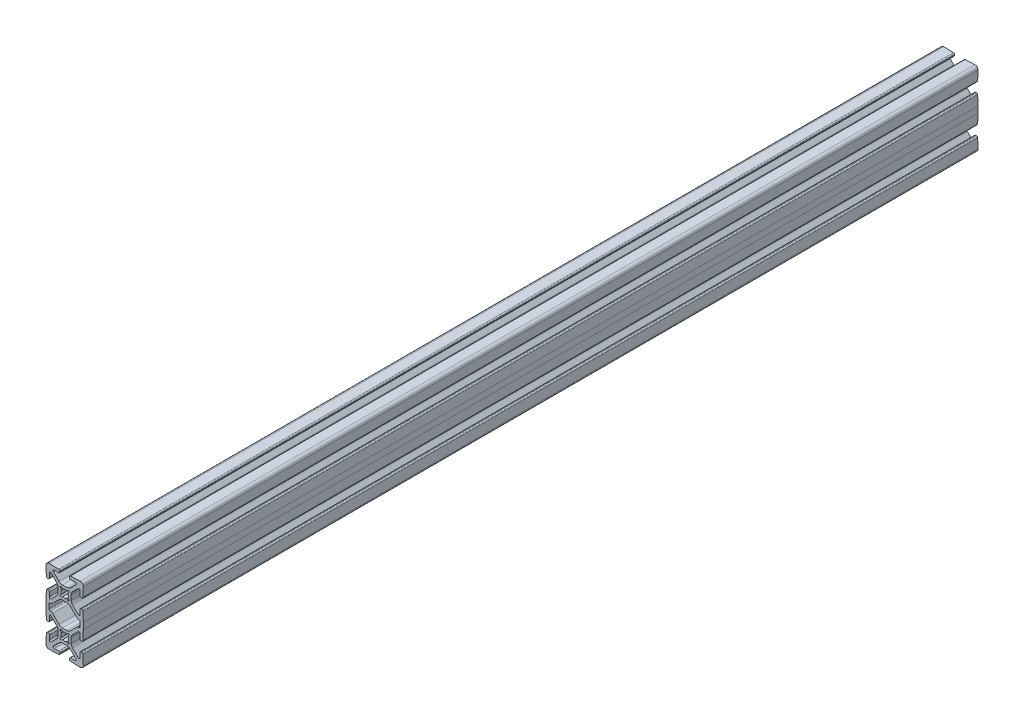
from build123d import *

# Parameters (mm, degrees)
BOSS_EXTRUDE1_DEPTH = 300
CIRPATTERN1_COUNT   = 2


with BuildPart() as part:
    # Sketch3 → Boss-Extrude1 (new, symmetric)
    with BuildSketch(Plane.XY):
        with BuildLine():
            Line((-4.38, 10.941265504), (-4.38, 14.058734496))
            ThreePointArc((-4.38, 14.058734496), (-4.621682484, 15.273754393), (-5.30993597, 16.303798526))
            Line((-5.30993597, 16.303798526), (-9.020191678, 20.014054234))
            ThreePointArc((-9.020191678, 20.014054234), (-9.863839779, 20.17422583), (-10.32206431, 19.447983903))
            Line((-10.32206431, 19.447983903), (-10.221143342, 16.5579855))
            ThreePointArc((-10.221143342, 16.5579855), (-10.425626604, 16.011070171), (-10.956945643, 15.768934135))
            Line((-10.956945643, 15.768934135), (-11.485840127, 15.750464733))
            ThreePointArc((-11.485840127, 15.750464733), (-12.032755455, 15.954947995), (-12.274891491, 16.486267034))
            Line((-12.274891491, 16.486267034), (-12.498762161, 22.897084223))
            ThreePointArc((-12.498762161, 22.897084223), (-11.904840979, 24.404840979), (-10.397084223, 24.998762161))
            Line((-10.397084223, 24.998762161), (-3.986267034, 24.774891491))
            ThreePointArc((-3.986267034, 24.774891491), (-3.454947995, 24.532755455), (-3.250464733, 23.985840127))
            Line((-3.250464733, 23.985840127), (-3.268934135, 23.456945643))
            ThreePointArc((-3.268934135, 23.456945643), (-3.511070171, 22.925626604), (-4.0579855, 22.721143342))
            Line((-4.0579855, 22.721143342), (-6.947983903, 22.82206431))
            ThreePointArc((-6.947983903, 22.82206431), (-7.67422583, 22.363839779), (-7.514054234, 21.520191678))
            Line((-7.514054234, 21.520191678), (-3.803798526, 17.80993597))
            ThreePointArc((-3.803798526, 17.80993597), (-2.773754393, 17.121682484), (-1.558734496, 16.88))
            Line((-1.558734496, 16.88), (1.558734496, 16.88))
            ThreePointArc((1.558734496, 16.88), (2.773754393, 17.121682484), (3.803798526, 17.80993597))
            Line((3.803798526, 17.80993597), (7.514054234, 21.520191678))
            ThreePointArc((7.514054234, 21.520191678), (7.67422583, 22.363839779), (6.947983903, 22.82206431))
            Line((6.947983903, 22.82206431), (4.0579855, 22.721143342))
            ThreePointArc((4.0579855, 22.721143342), (3.511070171, 22.925626604), (3.268934135, 23.456945643))
            Line((3.268934135, 23.456945643), (3.250464733, 23.985840127))
            ThreePointArc((3.250464733, 23.985840127), (3.454947995, 24.532755455), (3.986267034, 24.774891491))
            Line((3.986267034, 24.774891491), (10.397084223, 24.998762161))
            ThreePointArc((10.397084223, 24.998762161), (11.904840979, 24.404840979), (12.498762161, 22.897084223))
            Line((12.498762161, 22.897084223), (12.274891491, 16.486267034))
            ThreePointArc((12.274891491, 16.486267034), (12.032755455, 15.954947995), (11.485840127, 15.750464733))
            Line((11.485840127, 15.750464733), (10.956945643, 15.768934135))
            ThreePointArc((10.956945643, 15.768934135), (10.425626604, 16.011070171), (10.221143342, 16.5579855))
            Line((10.221143342, 16.5579855), (10.32206431, 19.447983903))
            ThreePointArc((10.32206431, 19.447983903), (9.863839779, 20.17422583), (9.020191678, 20.014054234))
            Line((9.020191678, 20.014054234), (5.30993597, 16.303798526))
            ThreePointArc((5.30993597, 16.303798526), (4.621682484, 15.273754393), (4.38, 14.058734496))
            Line((4.38, 14.058734496), (4.38, 10.941265504))
            ThreePointArc((4.38, 10.941265504), (4.621682484, 9.726245607), (5.30993597, 8.696201474))
            Line((5.30993597, 8.696201474), (9.020191678, 4.985945766))
            ThreePointArc((9.020191678, 4.985945766), (9.863839779, 4.82577417), (10.32206431, 5.552016097))
            Line((10.32206431, 5.552016097), (10.221143342, 8.4420145))
            ThreePointArc((10.221143342, 8.4420145), (10.425626604, 8.988929829), (10.956945643, 9.231065865))
            Line((10.956945643, 9.231065865), (11.485840127, 9.249535267))
            ThreePointArc((11.485840127, 9.249535267), (12.032755455, 9.045052005), (12.274891491, 8.513732966))
            Line((12.274891491, 8.513732966), (12.5, 2.067468692))
            Line((12.5, 2.067468692), (12.5, 0))
            Line((12.5, 0), (10.468, 0))
            Line((10.468, 0), (10.468, 1.506))
            ThreePointArc((10.468, 1.506), (10.244815367, 2.044815367), (9.706, 2.268))
            Line((9.706, 2.268), (9.567544515, 2.268))
            ThreePointArc((9.567544515, 2.268), (8.78993178, 2.42267679), (8.130703535, 2.863159021))
            Line((8.130703535, 2.863159021), (3.803798526, 7.19006403))
            ThreePointArc((3.803798526, 7.19006403), (2.773754393, 7.878317516), (1.558734496, 8.12))
            Line((1.558734496, 8.12), (-1.558734496, 8.12))
            ThreePointArc((-1.558734496, 8.12), (-2.773754393, 7.878317516), (-3.803798526, 7.19006403))
            Line((-3.803798526, 7.19006403), (-8.130703535, 2.863159021))
            ThreePointArc((-8.130703535, 2.863159021), (-8.78993178, 2.42267679), (-9.567544515, 2.268))
            Line((-9.567544515, 2.268), (-9.706, 2.268))
            ThreePointArc((-9.706, 2.268), (-10.244815367, 2.044815367), (-10.468, 1.506))
            Line((-10.468, 1.506), (-10.468, 0))
            Line((-10.468, 0), (-12.5, 0))
            Line((-12.5, 0), (-12.5, 2.067468692))
            Line((-12.5, 2.067468692), (-12.274891491, 8.513732966))
            ThreePointArc((-12.274891491, 8.513732966), (-12.032755455, 9.045052005), (-11.485840127, 9.249535267))
            Line((-11.485840127, 9.249535267), (-10.956945643, 9.231065865))
            ThreePointArc((-10.956945643, 9.231065865), (-10.425626604, 8.988929829), (-10.221143342, 8.4420145))
            Line((-10.221143342, 8.4420145), (-10.32206431, 5.552016097))
            ThreePointArc((-10.32206431, 5.552016097), (-9.863839779, 4.82577417), (-9.020191678, 4.985945766))
            Line((-9.020191678, 4.985945766), (-5.30993597, 8.696201474))
            ThreePointArc((-5.30993597, 8.696201474), (-4.621682484, 9.726245607), (-4.38, 10.941265504))
        make_face()
        with BuildLine():
            Line((-2.828427125, 14.430401513), (-2.195333939, 13.797308327))
            ThreePointArc((-2.195333939, 13.797308327), (-2.55, 12.5), (-2.195333939, 11.202691673))
            Line((-2.195333939, 11.202691673), (-2.828427125, 10.569598487))
            ThreePointArc((-2.828427125, 10.569598487), (-2.828427125, 9.671572875), (-1.930401513, 9.671572875))
            Line((-1.930401513, 9.671572875), (-1.297308327, 10.304666061))
            ThreePointArc((-1.297308327, 10.304666061), (0, 9.95), (1.297308327, 10.304666061))
            Line((1.297308327, 10.304666061), (1.930401513, 9.671572875))
            ThreePointArc((1.930401513, 9.671572875), (2.828427125, 9.671572875), (2.828427125, 10.569598487))
            Line((2.828427125, 10.569598487), (2.195333939, 11.202691673))
            ThreePointArc((2.195333939, 11.202691673), (2.55, 12.5), (2.195333939, 13.797308327))
            Line((2.195333939, 13.797308327), (2.828427125, 14.430401513))
            ThreePointArc((2.828427125, 14.430401513), (2.828427125, 15.328427125), (1.930401513, 15.328427125))
            Line((1.930401513, 15.328427125), (1.297308327, 14.695333939))
            ThreePointArc((1.297308327, 14.695333939), (0, 15.05), (-1.297308327, 14.695333939))
            Line((-1.297308327, 14.695333939), (-1.930401513, 15.328427125))
            ThreePointArc((-1.930401513, 15.328427125), (-2.828427125, 15.328427125), (-2.828427125, 14.430401513))
        make_face(mode=Mode.SUBTRACT)
    boss_extrude1 = extrude(amount=BOSS_EXTRUDE1_DEPTH, both=True)

    # CirPattern1: Boss-Extrude1 ×2 about axis
    cirpattern1_axis = Axis((0, 0, 300), (0, 0, -1))
    for i in range(1, CIRPATTERN1_COUNT):
        add(boss_extrude1.rotate(cirpattern1_axis, i * 360 / CIRPATTERN1_COUNT))


solid = part.part
